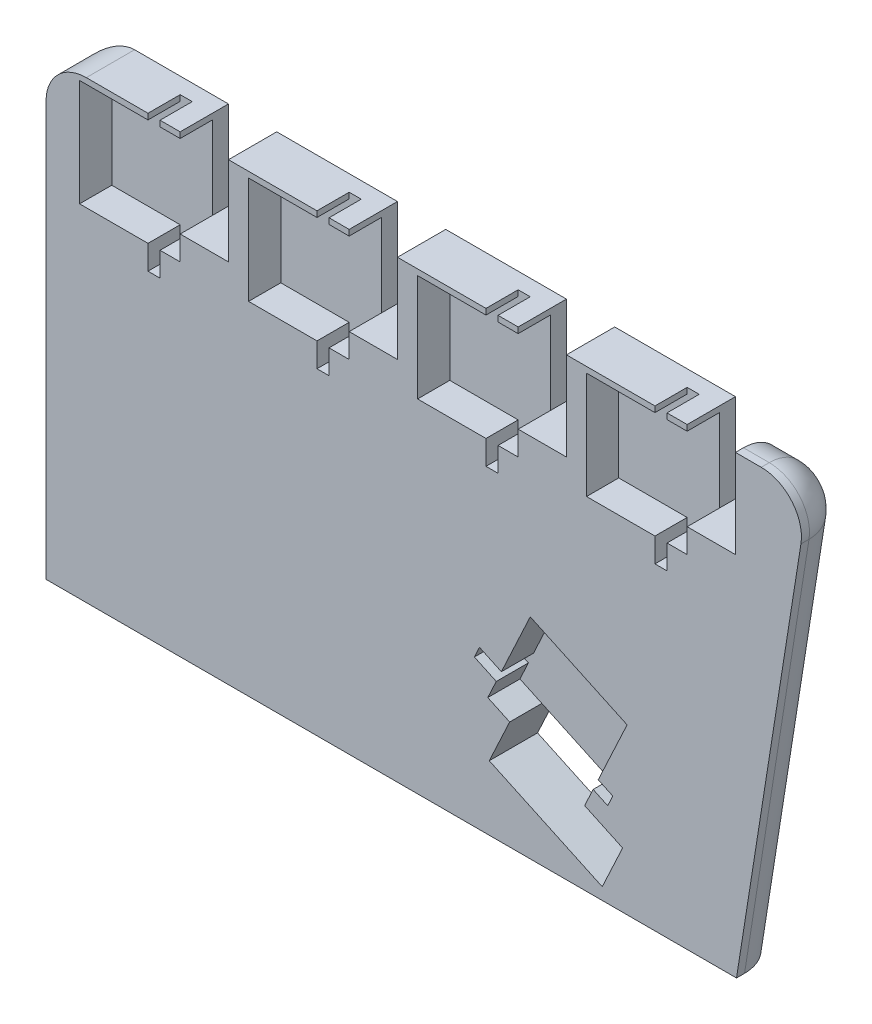
from build123d import *

# Parameters (mm, degrees)
BOSS_EXTRUDE1_DEPTH       = 12
SKETCH2_W                 = 25
SKETCH2_H                 = 26.555679241
CUT_EXTRUDE2_DEPTH        = 8
CUT_EXTRUDE8_START        = 4
SKETCH3_W                 = 3
SKETCH3_H                 = 36.555679241
CUT_EXTRUDE8_DEPTH        = 10
SKETCH5_W                 = 12
SKETCH5_H                 = 30.970366581
CUT_EXTRUDE10_DEPTH       = 18
LPATTERN1_COUNT           = 3
LPATTERN1_PITCH           = 42
LPATTERN2_COUNT           = 2
LPATTERN2_PITCH           = 42
CRVPATTERN1_START         = -70.397064899
CRVPATTERN1_OUTLINE_W     = 20.555679241
CRVPATTERN1_OUTLINE_H     = 8
CRVPATTERN1_DEPTH         = 37
CRVPATTERN1_2_DEPTH       = 12
CRVPATTERN1_START_2       = -58.397064899
CRVPATTERN1_3_OUTLINE_W   = 6
CRVPATTERN1_3_OUTLINE_H   = 8
CRVPATTERN1_3_DEPTH       = 25
CRVPATTERN1_START_3       = -53.397064899
CRVPATTERN1_4_OUTLINE_W   = 4
CRVPATTERN1_4_OUTLINE_H   = 8
CRVPATTERN1_4_OUTLINE_W_2 = 6
CRVPATTERN1_4_DEPTH       = 3
FILLET1_R                 = 10
FILLET2_R                 = 10
FILLET3_R                 = 10


# Read off the part's stored shape, not the designer's step: CrvPattern1
with BuildPart() as part:
    # Sketch1 → Boss-Extrude1 (new body)
    with BuildSketch(Plane.XY):
        Polygon((-111.658778955, 20), (77.777911134, 20), (59.936522952, -92.998049549), (-111.658778955, -92.998049549), align=None)
    extrude(amount=BOSS_EXTRUDE1_DEPTH)

    # Sketch2 → Cut-Extrude2 (cut)
    with BuildSketch(Plane.XY.offset(12)):
        with Locations((-6.829680892, 5.27783962)):
            Rectangle(SKETCH2_W, SKETCH2_H)
    cut_extrude2 = extrude(amount=-CUT_EXTRUDE2_DEPTH, mode=Mode.SUBTRACT)

    # Sketch3 → Cut-Extrude8 (cut)
    with BuildSketch(Plane.XY.offset(CUT_EXTRUDE8_START)):
        with Locations((-0.829680892, 4.27783962)):
            Rectangle(SKETCH3_W, SKETCH3_H)
    cut_extrude8 = extrude(amount=CUT_EXTRUDE8_DEPTH, mode=Mode.SUBTRACT)

    # Sketch5 → Cut-Extrude10 (cut)
    with BuildSketch(Plane.XY):
        with Locations((11.670319108, 13.485183291)):
            Rectangle(SKETCH5_W, SKETCH5_H)
    cut_extrude10 = extrude(amount=CUT_EXTRUDE10_DEPTH, mode=Mode.SUBTRACT)

    # LPattern1: Cut-Extrude2, Cut-Extrude8, Cut-Extrude10 ×3
    with Locations(*[(-i * LPATTERN1_PITCH, 0, 0) for i in range(1, LPATTERN1_COUNT)]):
        add(cut_extrude2, mode=Mode.SUBTRACT)
        add(cut_extrude8, mode=Mode.SUBTRACT)
        add(cut_extrude10, mode=Mode.SUBTRACT)

    # LPattern2: Cut-Extrude2, Cut-Extrude8, Cut-Extrude10 ×2
    with Locations(*[(i * LPATTERN2_PITCH, 0, 0) for i in range(1, LPATTERN2_COUNT)]):
        add(cut_extrude2, mode=Mode.SUBTRACT)
        add(cut_extrude8, mode=Mode.SUBTRACT)
        add(cut_extrude10, mode=Mode.SUBTRACT)

    # CrvPattern1 outline → CrvPattern1 (cut)
    with BuildSketch(Plane(origin=(0, 0, 0), x_dir=(0.906467226735628, -0.42227617367573506, 0), z_dir=(0.42227617367573506, 0.9064672267356281, 0)).offset(CRVPATTERN1_START)):
        with Locations((41.40893435, -8)):
            Rectangle(CRVPATTERN1_OUTLINE_W, CRVPATTERN1_OUTLINE_H)
    extrude(amount=CRVPATTERN1_DEPTH, mode=Mode.SUBTRACT)

    # CrvPattern1 2 outline → CrvPattern1 2 (cut)
    with BuildSketch(Plane(origin=(0, 0, 0), x_dir=(0.906467226735628, -0.42227617367573506, 0), z_dir=(0.42227617367573506, 0.9064672267356281, 0)).offset(CRVPATTERN1_START)):
        Polygon((51.68677397, -4), (51.68677397, -12), (62.10146131, -12), (62.10146131, 0), (31.131094729, 0), (31.131094729, -4), align=None)
    extrude(amount=CRVPATTERN1_2_DEPTH, mode=Mode.SUBTRACT)

    # CrvPattern1 3 outline → CrvPattern1 3 (cut)
    with BuildSketch(Plane(origin=(0, 0, 0), x_dir=(0.906467226735628, -0.42227617367573506, 0), z_dir=(0.42227617367573506, 0.9064672267356281, 0)).offset(CRVPATTERN1_START_2)):
        with Locations((28.131094729, -8)):
            Rectangle(CRVPATTERN1_3_OUTLINE_W, CRVPATTERN1_3_OUTLINE_H)
    extrude(amount=CRVPATTERN1_3_DEPTH, mode=Mode.SUBTRACT)

    # CrvPattern1 4 outline → CrvPattern1 4 (cut)
    with BuildSketch(Plane(origin=(0, 0, 0), x_dir=(0.906467226735628, -0.42227617367573506, 0), z_dir=(0.42227617367573506, 0.9064672267356281, 0)).offset(CRVPATTERN1_START_3)):
        with Locations((53.68677397, -8)):
            Rectangle(CRVPATTERN1_4_OUTLINE_W, CRVPATTERN1_4_OUTLINE_H)
        with Locations((22.131094729, -8)):
            Rectangle(CRVPATTERN1_4_OUTLINE_W_2, CRVPATTERN1_4_OUTLINE_H)
    extrude(amount=CRVPATTERN1_4_DEPTH, mode=Mode.SUBTRACT)

    # Fillet1
    fillet1_edges = [part.edges().sort_by_distance(p)[0] for p in [
        (77.777911134, 20, 6),
    ]]
    fillet(fillet1_edges, radius=FILLET1_R)

    # Fillet2
    fillet2_edges = [part.edges().sort_by_distance(p)[0] for p in [
        (-111.658778955, -36.499024774, 0),
        (-111.658778955, 20, 6),
    ]]
    fillet(fillet2_edges, radius=FILLET2_R)

    # Fillet3
    fillet3_edges = [part.edges().sort_by_distance(p)[0] for p in [
        (62.872719189, 20, 0),
        (73.677615847, 16.496310167, 0),
        (67.944638692, -42.278820195, 0),
    ]]
    fillet(fillet3_edges, radius=FILLET3_R)


solid = part.part
